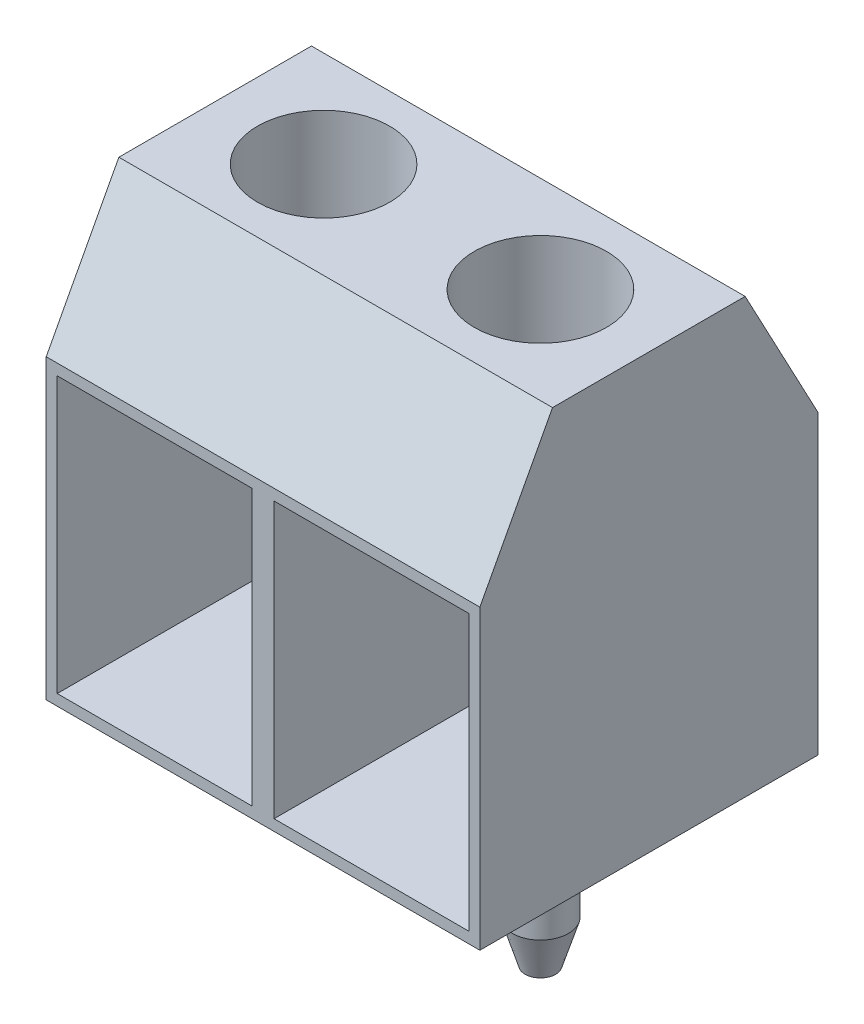
from build123d import *

# Parameters (mm, degrees)
SKETCH3_W                     = 10.0076
SKETCH3_H                     = 7.7978
BOSS_EXTRUDE1_DEPTH           = 10.0076
CUT_EXTRUDE1_DEPTH            = 10.0076
SKETCH5_R                     = 1.524
CUT_EXTRUDE2_DEPTH            = 2.54
SKETCH6_W                     = 4.4958
SKETCH6_H                     = 6.35
CUT_EXTRUDE3_DEPTH            = 5.08
SKETCH8_R                     = 0.6477
BOSS_EXTRUDE2_DEPTH           = 2.54
SKETCH9_R                     = 0.6477
BOSS_EXTRUDE3_DEPTH           = 0.9652
BOSS_EXTRUDE3_DRAFT           = 17
BOSS_EXTRUDE3_PROFILE_2_DEPTH = 0.9652
BOSS_EXTRUDE3_PROFILE_2_DRAFT = 17


with BuildPart() as part:
    # Sketch3 → Boss-Extrude1 (new body)
    with BuildSketch(Plane(origin=(0, 0, 0), x_dir=(1, 0, 0), z_dir=(0, 1, 0))):
        Rectangle(SKETCH3_W, SKETCH3_H)
    extrude(amount=BOSS_EXTRUDE1_DEPTH)

    # Sketch4 → Cut-Extrude1 (cut)
    with BuildSketch(Plane.ZY.offset(5.0038)):
        Polygon((-3.8989, 10.0076), (-3.8989, 6.858), (-2.2225, 10.0076), align=None)
        Polygon((3.8989, 10.0076), (2.2225, 10.0076), (3.8989, 6.858), align=None)
    extrude(amount=-CUT_EXTRUDE1_DEPTH, mode=Mode.SUBTRACT)

    # Sketch5 → Cut-Extrude2 (cut)
    with BuildSketch(Plane(origin=(0, 10.0076, 0), x_dir=(1, 0, 0), z_dir=(0, 1, 0))):
        with Locations((-2.5019, 0)):
            Circle(SKETCH5_R)
        with Locations((2.5019, 0)):
            Circle(SKETCH5_R)
    extrude(amount=-CUT_EXTRUDE2_DEPTH, mode=Mode.SUBTRACT)

    # Sketch6 → Cut-Extrude3 (cut)
    with BuildSketch(Plane.XY.offset(3.8989)):
        with Locations((-2.5019, 3.429)):
            Rectangle(SKETCH6_W, SKETCH6_H)
        with Locations((2.5019, 3.429)):
            Rectangle(SKETCH6_W, SKETCH6_H)
    extrude(amount=-CUT_EXTRUDE3_DEPTH, mode=Mode.SUBTRACT)

    # Sketch8 → Boss-Extrude2 (add)
    with BuildSketch(Plane.XZ):
        with Locations((-2.5019, 0)):
            Circle(SKETCH8_R)
        with Locations((2.5019, 0)):
            Circle(SKETCH8_R)
    extrude(amount=BOSS_EXTRUDE2_DEPTH)


with BuildPart() as boss_extrude3_tool:
    # Sketch9 → Boss-Extrude3 (with draft: the straight prism first)
    with BuildSketch(Plane.XZ.offset(2.54)):
        with Locations((2.5019, 0)):
            Circle(SKETCH9_R)
    extrude(amount=BOSS_EXTRUDE3_DEPTH)
    # Boss-Extrude3: the draft: its side faces are tilted about the plane it starts from
    boss_extrude3_sides = [boss_extrude3_tool.faces().sort_by_distance(p)[0] for p in [
        (1.8542, -3.0226, 0),
    ]]
    draft(boss_extrude3_sides, Plane.XZ.offset(2.54), BOSS_EXTRUDE3_DRAFT)


with BuildPart() as part_1:
    add(part.part)

    # Boss-Extrude3: add boss_extrude3_tool
    add(boss_extrude3_tool.part)


with BuildPart() as boss_extrude3_profile_2_tool:
    # Sketch9 → Boss-Extrude3 profile 2 (with draft: the straight prism first)
    with BuildSketch(Plane.XZ.offset(2.54)):
        with Locations((-2.5019, 0)):
            Circle(SKETCH9_R)
    extrude(amount=BOSS_EXTRUDE3_PROFILE_2_DEPTH)
    # Boss-Extrude3 profile 2: the draft: its side faces are tilted about the plane it starts from
    boss_extrude3_profile_2_sides = [boss_extrude3_profile_2_tool.faces().sort_by_distance(p)[0] for p in [
        (-3.1496, -3.0226, 0),
    ]]
    draft(boss_extrude3_profile_2_sides, Plane.XZ.offset(2.54), BOSS_EXTRUDE3_PROFILE_2_DRAFT)


with BuildPart() as part_2:
    add(part_1.part)

    # Boss-Extrude3 profile 2: add boss_extrude3_profile_2_tool
    add(boss_extrude3_profile_2_tool.part)


solid = part_2.part
